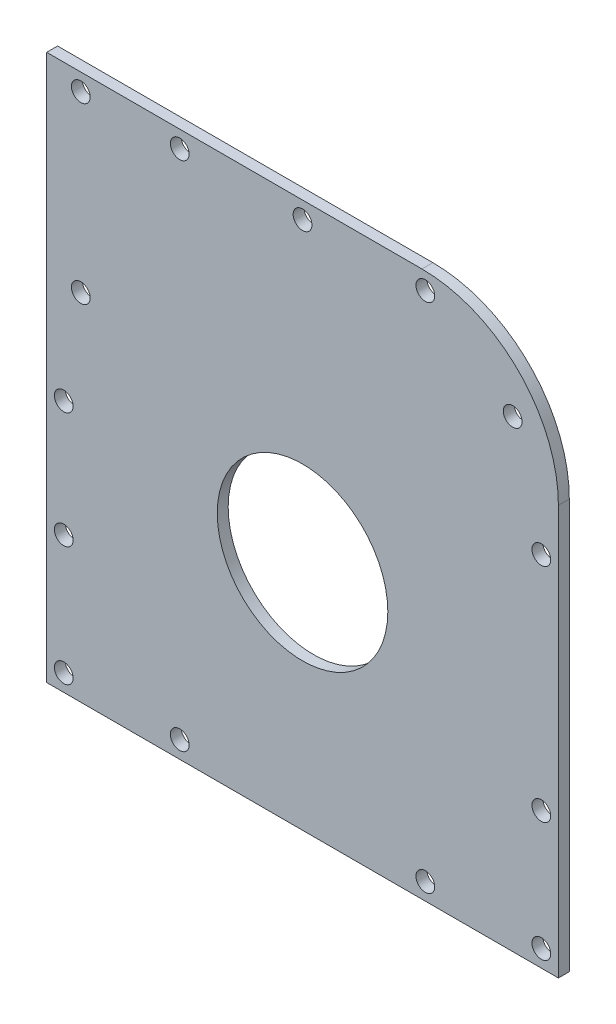
from build123d import *

# Parameters (mm, degrees)
SKETCH1_W           = 150
SKETCH1_H           = 160
BOSS_EXTRUDE1_DEPTH = 3.2
CUT_EXTRUDE1_REACH  = 111.705
SKETCH2_R           = 25
FILLET2_R           = 40
CUT_EXTRUDE2_REACH  = 111.705
SKETCH3_R           = 2.75


with BuildPart() as part:
    # Sketch1 → Boss-Extrude1 (new body)
    with BuildSketch(Plane.XY):
        Rectangle(SKETCH1_W, SKETCH1_H)
    extrude(amount=BOSS_EXTRUDE1_DEPTH)

    # Sketch2 → Cut-Extrude1 (cut, up to next)
    with BuildSketch(Plane.XY.offset(3.2), mode=Mode.PRIVATE) as cut_extrude1_sk1:
        with Locations((0, -12)):
            Circle(SKETCH2_R)
    cut_extrude1_tool1 = extrude(cut_extrude1_sk1.sketch, amount=-CUT_EXTRUDE1_REACH, mode=Mode.PRIVATE) & part.part
    add(cut_extrude1_tool1.solids().sort_by_distance((0, -12, 3.2))[0], mode=Mode.SUBTRACT)

    # Fillet2
    fillet2_edges = [part.edges().sort_by_distance(p)[0] for p in [
        (75, 80, 1.6),
    ]]
    fillet(fillet2_edges, radius=FILLET2_R)

    # Sketch3 → Cut-Extrude2 (cut, up to next)
    with BuildSketch(Plane(origin=(0, 0, 0), x_dir=(-1, 0, 0), z_dir=(0, 0, -1)), mode=Mode.PRIVATE) as cut_extrude2_sk1:
        with Locations((65, 24)):
            Circle(SKETCH3_R)
    cut_extrude2_tool1 = extrude(cut_extrude2_sk1.sketch, amount=-CUT_EXTRUDE2_REACH, mode=Mode.PRIVATE) & part.part
    # Sketch3 → Cut-Extrude2 (cut, up to next)
    with BuildSketch(Plane(origin=(0, 0, 0), x_dir=(-1, 0, 0), z_dir=(0, 0, -1)), mode=Mode.PRIVATE) as cut_extrude2_sk2:
        with Locations((-70, -75)):
            Circle(SKETCH3_R)
    cut_extrude2_tool2 = extrude(cut_extrude2_sk2.sketch, amount=-CUT_EXTRUDE2_REACH, mode=Mode.PRIVATE) & part.part
    # Sketch3 → Cut-Extrude2 (cut, up to next)
    with BuildSketch(Plane(origin=(0, 0, 0), x_dir=(-1, 0, 0), z_dir=(0, 0, -1)), mode=Mode.PRIVATE) as cut_extrude2_sk3:
        with Locations((36, -75)):
            Circle(SKETCH3_R)
    cut_extrude2_tool3 = extrude(cut_extrude2_sk3.sketch, amount=-CUT_EXTRUDE2_REACH, mode=Mode.PRIVATE) & part.part
    # Sketch3 → Cut-Extrude2 (cut, up to next)
    with BuildSketch(Plane(origin=(0, 0, 0), x_dir=(-1, 0, 0), z_dir=(0, 0, -1)), mode=Mode.PRIVATE) as cut_extrude2_sk4:
        with Locations((-36, -75)):
            Circle(SKETCH3_R)
    cut_extrude2_tool4 = extrude(cut_extrude2_sk4.sketch, amount=-CUT_EXTRUDE2_REACH, mode=Mode.PRIVATE) & part.part
    # Sketch3 → Cut-Extrude2 (cut, up to next)
    with BuildSketch(Plane(origin=(0, 0, 0), x_dir=(-1, 0, 0), z_dir=(0, 0, -1)), mode=Mode.PRIVATE) as cut_extrude2_sk5:
        with Locations((70, -75)):
            Circle(SKETCH3_R)
    cut_extrude2_tool5 = extrude(cut_extrude2_sk5.sketch, amount=-CUT_EXTRUDE2_REACH, mode=Mode.PRIVATE) & part.part
    # Sketch3 → Cut-Extrude2 (cut, up to next)
    with BuildSketch(Plane(origin=(0, 0, 0), x_dir=(-1, 0, 0), z_dir=(0, 0, -1)), mode=Mode.PRIVATE) as cut_extrude2_sk6:
        with Locations((-70, -40)):
            Circle(SKETCH3_R)
    cut_extrude2_tool6 = extrude(cut_extrude2_sk6.sketch, amount=-CUT_EXTRUDE2_REACH, mode=Mode.PRIVATE) & part.part
    # Sketch3 → Cut-Extrude2 (cut, up to next)
    with BuildSketch(Plane(origin=(0, 0, 0), x_dir=(-1, 0, 0), z_dir=(0, 0, -1)), mode=Mode.PRIVATE) as cut_extrude2_sk7:
        with Locations((-70, 25)):
            Circle(SKETCH3_R)
    cut_extrude2_tool7 = extrude(cut_extrude2_sk7.sketch, amount=-CUT_EXTRUDE2_REACH, mode=Mode.PRIVATE) & part.part
    # Sketch3 → Cut-Extrude2 (cut, up to next)
    with BuildSketch(Plane(origin=(0, 0, 0), x_dir=(-1, 0, 0), z_dir=(0, 0, -1)), mode=Mode.PRIVATE) as cut_extrude2_sk8:
        with Locations((-36, 75)):
            Circle(SKETCH3_R)
    cut_extrude2_tool8 = extrude(cut_extrude2_sk8.sketch, amount=-CUT_EXTRUDE2_REACH, mode=Mode.PRIVATE) & part.part
    # Sketch3 → Cut-Extrude2 (cut, up to next)
    with BuildSketch(Plane(origin=(0, 0, 0), x_dir=(-1, 0, 0), z_dir=(0, 0, -1)), mode=Mode.PRIVATE) as cut_extrude2_sk9:
        with Locations((36, 75)):
            Circle(SKETCH3_R)
    cut_extrude2_tool9 = extrude(cut_extrude2_sk9.sketch, amount=-CUT_EXTRUDE2_REACH, mode=Mode.PRIVATE) & part.part
    # Sketch3 → Cut-Extrude2 (cut, up to next)
    with BuildSketch(Plane(origin=(0, 0, 0), x_dir=(-1, 0, 0), z_dir=(0, 0, -1)), mode=Mode.PRIVATE) as cut_extrude2_sk10:
        with Locations((65, 75)):
            Circle(SKETCH3_R)
    cut_extrude2_tool10 = extrude(cut_extrude2_sk10.sketch, amount=-CUT_EXTRUDE2_REACH, mode=Mode.PRIVATE) & part.part
    # Sketch3 → Cut-Extrude2 (cut, up to next)
    with BuildSketch(Plane(origin=(0, 0, 0), x_dir=(-1, 0, 0), z_dir=(0, 0, -1)), mode=Mode.PRIVATE) as cut_extrude2_sk11:
        with Locations((70, -40)):
            Circle(SKETCH3_R)
    cut_extrude2_tool11 = extrude(cut_extrude2_sk11.sketch, amount=-CUT_EXTRUDE2_REACH, mode=Mode.PRIVATE) & part.part
    # Sketch3 → Cut-Extrude2 (cut, up to next)
    with BuildSketch(Plane(origin=(0, 0, 0), x_dir=(-1, 0, 0), z_dir=(0, 0, -1)), mode=Mode.PRIVATE) as cut_extrude2_sk12:
        with Locations((70, -6)):
            Circle(SKETCH3_R)
    cut_extrude2_tool12 = extrude(cut_extrude2_sk12.sketch, amount=-CUT_EXTRUDE2_REACH, mode=Mode.PRIVATE) & part.part
    # Sketch3 → Cut-Extrude2 (cut, up to next)
    with BuildSketch(Plane(origin=(0, 0, 0), x_dir=(-1, 0, 0), z_dir=(0, 0, -1)), mode=Mode.PRIVATE) as cut_extrude2_sk13:
        with Locations((0, 75)):
            Circle(SKETCH3_R)
    cut_extrude2_tool13 = extrude(cut_extrude2_sk13.sketch, amount=-CUT_EXTRUDE2_REACH, mode=Mode.PRIVATE) & part.part
    # Sketch3 → Cut-Extrude2 (cut, up to next)
    with BuildSketch(Plane(origin=(0, 0, 0), x_dir=(-1, 0, 0), z_dir=(0, 0, -1)), mode=Mode.PRIVATE) as cut_extrude2_sk14:
        with Locations((-61.592770869, 55.875856237)):
            Circle(SKETCH3_R)
    cut_extrude2_tool14 = extrude(cut_extrude2_sk14.sketch, amount=-CUT_EXTRUDE2_REACH, mode=Mode.PRIVATE) & part.part
    add(cut_extrude2_tool1.solids().sort_by_distance((-65, 24, 0))[0], mode=Mode.SUBTRACT)
    add(cut_extrude2_tool2.solids().sort_by_distance((70, -75, 0))[0], mode=Mode.SUBTRACT)
    add(cut_extrude2_tool3.solids().sort_by_distance((-36, -75, 0))[0], mode=Mode.SUBTRACT)
    add(cut_extrude2_tool4.solids().sort_by_distance((36, -75, 0))[0], mode=Mode.SUBTRACT)
    add(cut_extrude2_tool5.solids().sort_by_distance((-70, -75, 0))[0], mode=Mode.SUBTRACT)
    add(cut_extrude2_tool6.solids().sort_by_distance((70, -40, 0))[0], mode=Mode.SUBTRACT)
    add(cut_extrude2_tool7.solids().sort_by_distance((70, 25, 0))[0], mode=Mode.SUBTRACT)
    add(cut_extrude2_tool8.solids().sort_by_distance((36, 75, 0))[0], mode=Mode.SUBTRACT)
    add(cut_extrude2_tool9.solids().sort_by_distance((-36, 75, 0))[0], mode=Mode.SUBTRACT)
    add(cut_extrude2_tool10.solids().sort_by_distance((-65, 75, 0))[0], mode=Mode.SUBTRACT)
    add(cut_extrude2_tool11.solids().sort_by_distance((-70, -40, 0))[0], mode=Mode.SUBTRACT)
    add(cut_extrude2_tool12.solids().sort_by_distance((-70, -6, 0))[0], mode=Mode.SUBTRACT)
    add(cut_extrude2_tool13.solids().sort_by_distance((0, 75, 0))[0], mode=Mode.SUBTRACT)
    add(cut_extrude2_tool14.solids().sort_by_distance((61.592771, 55.875856, 0))[0], mode=Mode.SUBTRACT)


solid = part.part
